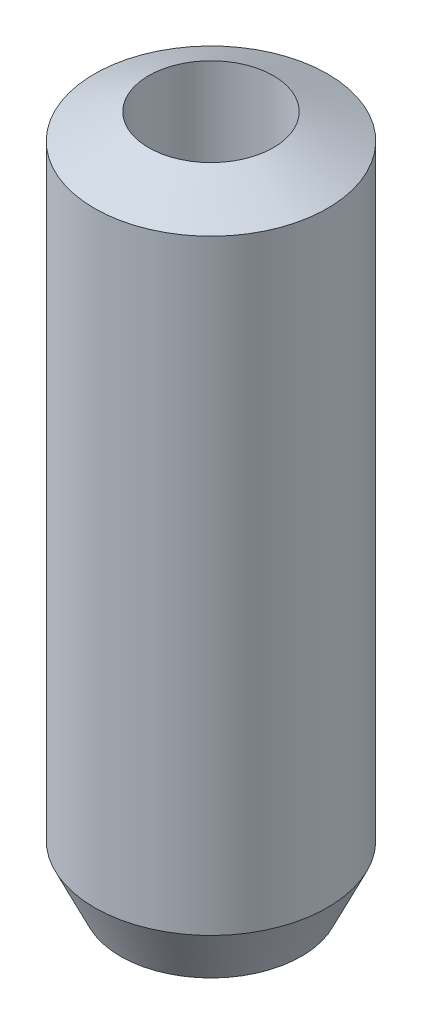
from build123d import *

# Parameters (mm, degrees)
SKETCH1_R           = 10
BOSS_EXTRUDE1_DEPTH = 58.936155
SKETCH2_R           = 5.355344486
CUT_EXTRUDE1_DEPTH  = 61.609160745
CHAMFER1_SIZE       = 2.231303
CHAMFER1_SIZE_2     = 4.737323


with BuildPart() as part:
    # Sketch1 → Boss-Extrude1 (new body)
    with BuildSketch(Plane(origin=(0, 0, 0), x_dir=(1, 0, 0), z_dir=(0, 1, 0))):
        with Locations(Location((0, 0, 0), (0, 0, 270))):
            Circle(SKETCH1_R)
    extrude(amount=BOSS_EXTRUDE1_DEPTH)

    # Sketch2 → Cut-Extrude1 (cut, through all)
    with BuildSketch(Plane(origin=(0, 0, 0), x_dir=(1, 0, 0), z_dir=(0, 1, 0))):
        with Locations(Location((0, 0, 0), (0, 0, 270))):
            Circle(SKETCH2_R)
    extrude(amount=CUT_EXTRUDE1_DEPTH, mode=Mode.SUBTRACT)

    # Chamfer1
    # the kernel refuses this chamfer: 4.737323, 2.231303 mm, written as the material it takes off along each edge
    with BuildSketch(Plane(origin=(0, 58.936155, 0), x_dir=(0, 0, 1), z_dir=(-1, 0, 0))) as chamfer1_piece_1:
        Polygon((10, -CHAMFER1_SIZE), (10 - CHAMFER1_SIZE_2, 0), (10, 0), align=None)
    revolve(axis=Axis((0, 58.936155, 0), (0, 1, 0)), mode=Mode.SUBTRACT)
    with BuildSketch(Plane(origin=(0, 0, 0), x_dir=(0, 0, 1), z_dir=(-1, 0, 0))) as chamfer1_piece_2:
        Polygon((10, CHAMFER1_SIZE_2), (10 - CHAMFER1_SIZE, 0), (10, 0), align=None)
    revolve(axis=Axis((0, 0, 0), (0, 1, 0)), mode=Mode.SUBTRACT)


solid = part.part
